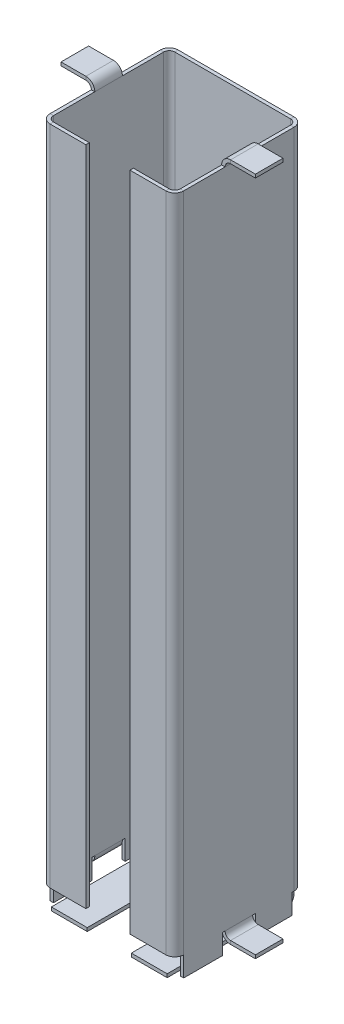
from build123d import *

# Parameters (mm, degrees)
BASE_FLANGE1_DEPTH   = 304.8
EDGE_FLANGE3_DEPTH   = 53.34
SKETCH14_W           = 20.32
SKETCH14_H           = 69.210930463
CUT_EXTRUDE1_DEPTH   = 9.4615
EDGE_FLANGE4_DEPTH   = 12.7
MIRROR2_COPY_1_DEPTH = 12.7
SKETCH22_W           = 17.803399203
SKETCH22_H           = 9.246782325
SKETCH22_W_2         = 16.822955406
TAB1_DEPTH           = 1.5875


# Sheet-metal steps are written as plain solids
with BuildPart() as part:
    # Sketch1 → Base-Flange1 (new body)
    with BuildSketch(Plane(origin=(0, 0, 0), x_dir=(1, 0, 0), z_dir=(0, 1, 0))):
        with BuildLine():
            Line((19.05, 0), (2.54, 0))
            ThreePointArc((2.54, 0), (0.743948776, 0.743948776), (0, 2.54))
            Line((0, 2.54), (0, 53.34))
            ThreePointArc((0, 53.34), (0.743948776, 55.136051224), (2.54, 55.88))
            Line((2.54, 55.88), (55.88, 55.88))
            ThreePointArc((55.88, 55.88), (57.676051224, 55.136051224), (58.42, 53.34))
            Line((58.42, 53.34), (58.42, 2.54))
            ThreePointArc((58.42, 2.54), (57.676051224, 0.743948776), (55.88, 0))
            Line((55.88, 0), (39.37, 0))
            Line((39.37, 0), (39.37, -1.5875))
            Line((39.37, -1.5875), (55.88, -1.5875))
            ThreePointArc((55.88, -1.5875), (58.798583239, -0.378583239), (60.0075, 2.54))
            Line((60.0075, 2.54), (60.0075, 53.34))
            ThreePointArc((60.0075, 53.34), (58.798583239, 56.258583239), (55.88, 57.4675))
            Line((55.88, 57.4675), (2.54, 57.4675))
            ThreePointArc((2.54, 57.4675), (-0.378583239, 56.258583239), (-1.5875, 53.34))
            Line((-1.5875, 53.34), (-1.5875, 2.54))
            ThreePointArc((-1.5875, 2.54), (-0.378583239, -0.378583239), (2.54, -1.5875))
            Line((2.54, -1.5875), (19.05, -1.5875))
            Line((19.05, -1.5875), (19.05, 0))
        make_face()
    extrude(amount=BASE_FLANGE1_DEPTH)

    # Edge-Flange3 section (across the edge) → Edge-Flange3 (add)
    with BuildSketch(Plane(origin=(2.54, -7.874, -55.88), x_dir=(0, 1, 0), z_dir=(1, 0, 0))):
        with BuildLine():
            Line((-1.5875, 2.54), (-1.5875, 56.8325))
            Line((-1.5875, 56.8325), (0, 56.8325))
            Line((0, 56.8325), (0, 2.54))
            ThreePointArc((0, 2.54), (0.743948776, 0.743948776), (2.54, 0))
            Line((2.54, 0), (7.874, 0))
            Line((7.874, 0), (7.874, -1.5875))
            Line((7.874, -1.5875), (2.54, -1.5875))
            ThreePointArc((2.54, -1.5875), (-0.378583239, -0.378583239), (-1.5875, 2.54))
        make_face()
    extrude(amount=EDGE_FLANGE3_DEPTH)

    # Sketch14 → Cut-Extrude1 (cut)
    with BuildSketch(Plane.XZ.offset(9.4615)):
        with Locations((29.21, -26.70801644)):
            Rectangle(SKETCH14_W, SKETCH14_H)
    extrude(amount=-CUT_EXTRUDE1_DEPTH, mode=Mode.SUBTRACT)

    # Edge-Flange4 section (across the edge) → Edge-Flange4 (add)
    with BuildSketch(Plane(origin=(-1.5875, 307.34, -21.59), x_dir=(0, -1, 0), z_dir=(0, 0, -1))):
        with BuildLine():
            Line((-1.5875, 2.54), (-1.5875, 13.97))
            Line((-1.5875, 13.97), (0, 13.97))
            Line((0, 13.97), (0, 2.54))
            ThreePointArc((0, 2.54), (0.743948776, 0.743948776), (2.54, 0))
            Line((2.54, 0), (2.54, -1.5875))
            ThreePointArc((2.54, -1.5875), (-0.378583239, -0.378583239), (-1.5875, 2.54))
        make_face()
    edge_flange4 = extrude(amount=EDGE_FLANGE4_DEPTH)

    # Mirror1: Edge-Flange4 across plane
    add(edge_flange4.mirror(Plane(origin=(29.21, 0, 0), x_dir=(0, 0, 1), z_dir=(1, 0, 0))))

    # Mirror2: Edge-Flange4 across plane
    add(edge_flange4.mirror(Plane.ZX.offset(152.4)))

    # Mirror2 copy 1 sketch → Mirror2 copy 1 (add)
    with BuildSketch(Plane(origin=(60.0075, -2.54, -21.59), x_dir=(0, 1, 0), z_dir=(0, 0, -1))):
        with BuildLine():
            Line((-1.5875, 2.54), (-1.5875, 13.97))
            Line((-1.5875, 13.97), (0, 13.97))
            Line((0, 13.97), (0, 2.54))
            ThreePointArc((0, 2.54), (0.743948776, 0.743948776), (2.54, 0))
            Line((2.54, 0), (2.54, -1.5875))
            ThreePointArc((2.54, -1.5875), (-0.378583239, -0.378583239), (-1.5875, 2.54))
        make_face()
    extrude(amount=MIRROR2_COPY_1_DEPTH)

    # Sketch22 → Tab1 (add)
    with BuildSketch(Plane(origin=(60.0075, 0, 0), x_dir=(0, 0, -1), z_dir=(1, 0, 0))):
        with Locations((11.441699601, -4.623391162)):
            Rectangle(SKETCH22_W, SKETCH22_H)
        with Locations((44.004958561, -4.623391162)):
            Rectangle(SKETCH22_W_2, SKETCH22_H)
    tab1 = extrude(amount=-TAB1_DEPTH)

    # Mirror3: Tab1 across plane
    add(tab1.mirror(Plane(origin=(29.21, 0, 0), x_dir=(0, 0, 1), z_dir=(1, 0, 0))))


solid = part.part
